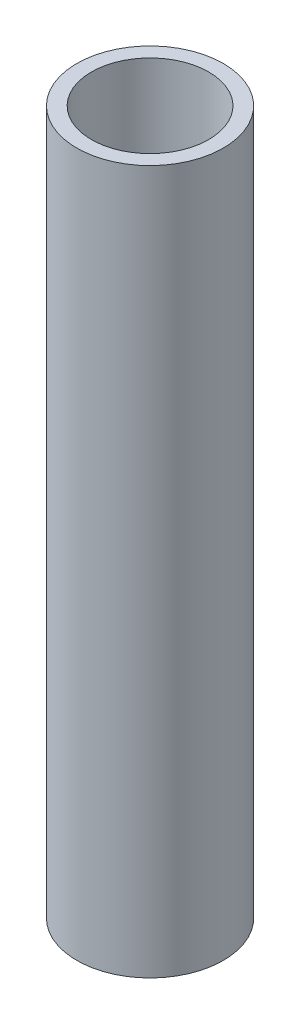
from build123d import *

# Parameters (mm, degrees)
SKETCH2_R           = 7.9375
SKETCH2_R_2         = 6.35
BOSS_EXTRUDE1_DEPTH = 76.2


with BuildPart() as part:
    # Sketch2 → Boss-Extrude1 (new body)
    with BuildSketch(Plane(origin=(0, 0, 0), x_dir=(1, 0, 0), z_dir=(0, 1, 0))):
        Circle(SKETCH2_R)
        Circle(SKETCH2_R_2, mode=Mode.SUBTRACT)
    extrude(amount=BOSS_EXTRUDE1_DEPTH)


solid = part.part
